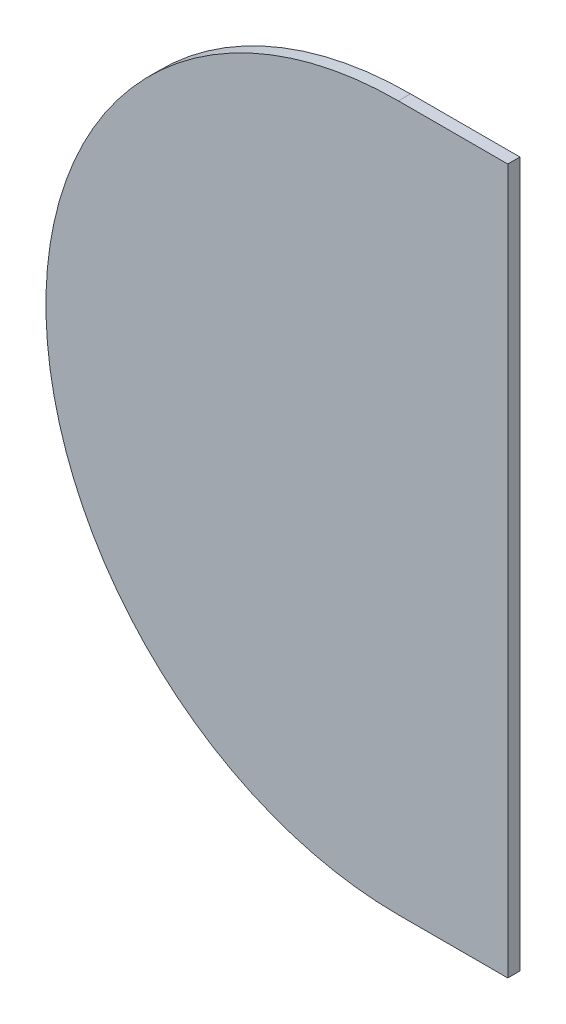
from build123d import *

# Parameters (mm, degrees)
BOSS_EXTRUDE1_DEPTH = 30


with BuildPart() as part:
    # Sketch1 → Boss-Extrude1 (new body)
    with BuildSketch(Plane.XY):
        with BuildLine():
            Line((0, 0), (270, 0))
            Line((270, 0), (270, 1740))
            Line((270, 1740), (0, 1740))
            ThreePointArc((0, 1740), (-870, 870), (0, 0))
        make_face()
    extrude(amount=BOSS_EXTRUDE1_DEPTH)


solid = part.part
